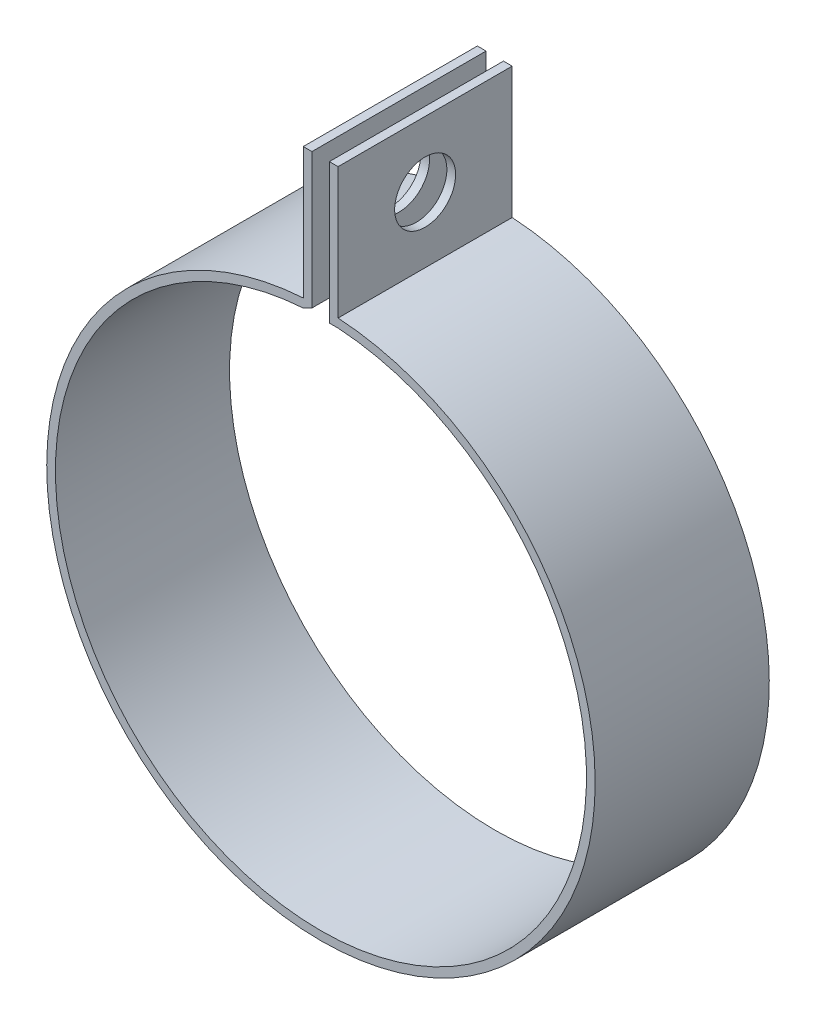
from build123d import *

# Parameters (mm, degrees)
SALIENTE_EXTRUIR1_DEPTH = 10
CROQUIS2_R              = 1.75
CORTAR_EXTRUIR1_DEPTH   = 10


with BuildPart() as part:
    # Croquis1 → Saliente-Extruir1 (new body)
    with BuildSketch(Plane.XY):
        with BuildLine():
            Line((-1, 15.217177794), (-0.516129032, 15.468000754))
            Line((-0.516129032, 15.468000754), (-0.516129032, 23.25))
            Line((-0.516129032, 23.25), (-1.016129032, 23.25))
            Line((-1.016129032, 23.25), (-1.016129032, 15.717187464))
            ThreePointArc((-1.016129032, 15.717187464), (0.016161641, -15.749991708), (0.983870968, 15.719239737))
            Line((0.983870968, 15.719239737), (0.983870968, 23.25))
            Line((0.983870968, 23.25), (0.483870968, 23.25))
            Line((0.483870968, 23.25), (0.483870968, 20.217983519))
            Line((0.483870968, 20.217983519), (0.483870968, 15.217177794))
            Line((0.483870968, 15.217177794), (1, 15.217177794))
            ThreePointArc((1, 15.217177794), (0, -15.25), (-1, 15.217177794))
        make_face()
    extrude(amount=SALIENTE_EXTRUIR1_DEPTH)

    # Croquis2 → Cortar-Extruir1 (cut)
    with BuildSketch(Plane(origin=(0.983870968, 0, 0), x_dir=(0, 0, -1), z_dir=(1, 0, 0))):
        with Locations((-5, 19.484619869)):
            Circle(CROQUIS2_R)
    extrude(amount=-CORTAR_EXTRUIR1_DEPTH, mode=Mode.SUBTRACT)


solid = part.part
